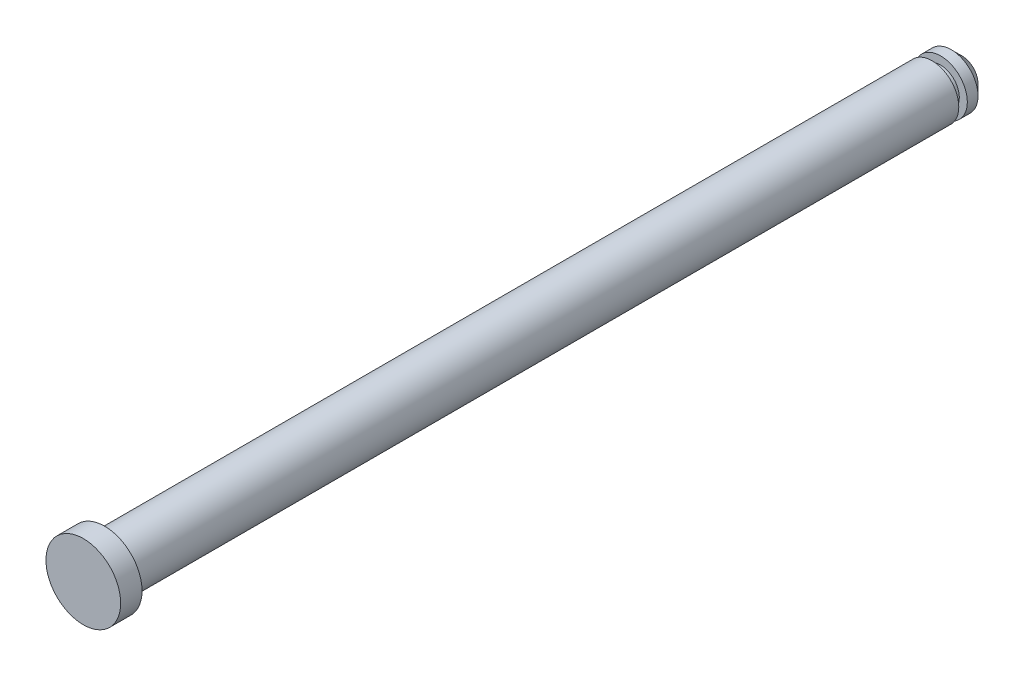
from build123d import *

# Parameters (mm, degrees)
CHAMFER_1_SIZE = 1


with BuildPart() as part:
    # 草图1 → 旋转1 (revolve)
    with BuildSketch(Plane(origin=(0, 0, 0), x_dir=(0, 0, -1), z_dir=(1, 0, 0))):
        Polygon((79.5, 2.5), (2, 2.5), (2, 3.5), (0, 3.5), (0, 0), (82.3, 0), (82.3, 2.5), (80.3, 2.5), (80.3, 1.75), (79.5, 1.75), align=None)
    revolve(axis=Axis((0, 0, 0), (0, 0, -1)))

    # 倒角1
    chamfer_1_edges = [part.edges().sort_by_distance(p)[0] for p in [
        (0, -2.5, -82.3),
    ]]
    chamfer(chamfer_1_edges, length=CHAMFER_1_SIZE)


solid = part.part
